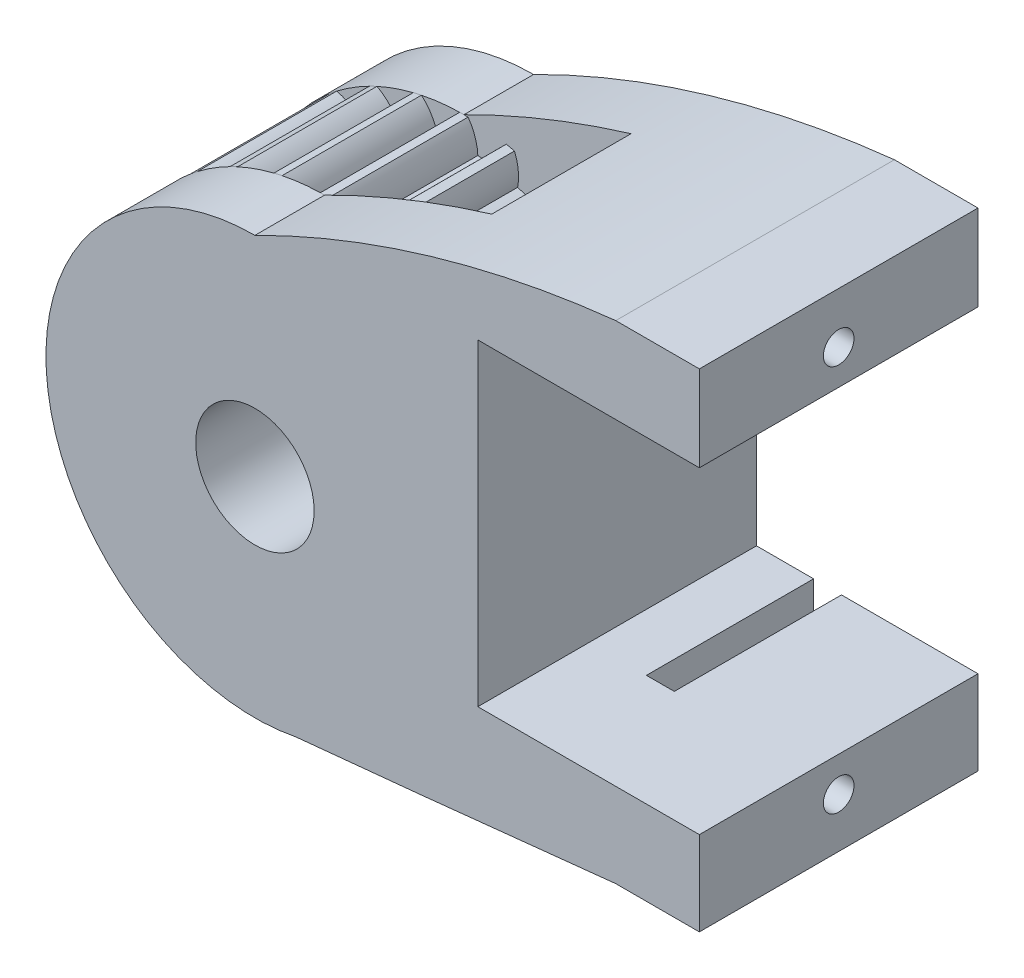
from build123d import *

# Parameters (mm, degrees)
SKETCH2_R           = 13
SKETCH2_R_2         = 4.25
BOSS_EXTRUDE1_DEPTH = 10
BOSS_EXTRUDE2_DEPTH = 10
CIRPATTERN1_COUNT   = 28
SKETCH3_R           = 15
SKETCH3_R_2         = 7.5
BOSS_EXTRUDE3_DEPTH = 5
SKETCH5_R           = 7.5
SKETCH5_R_2         = 4.25
BOSS_EXTRUDE4_DEPTH = 5
SKETCH6_W           = 6
SKETCH6_H           = 6.15
SKETCH6_H_2         = 6.05
BOSS_EXTRUDE7_DEPTH = 10
BOSS_EXTRUDE8_DEPTH = 5
CUT_EXTRUDE6_DEPTH  = 5
SKETCH18_R          = 1.1
CUT_EXTRUDE7_DEPTH  = 5
SKETCH20_W          = 2
SKETCH20_H          = 7.74649067
CUT_EXTRUDE10_DEPTH = 12


# Read off the part's stored shape, not the designer's step: Cut-Extrude6
with BuildPart() as part:
    # Sketch2 → Boss-Extrude1 (new body)
    with BuildSketch(Plane.XY):
        Circle(SKETCH2_R)
        Circle(SKETCH2_R_2, mode=Mode.SUBTRACT)
    extrude(amount=BOSS_EXTRUDE1_DEPTH)

    # Sketch2<3> → Boss-Extrude2 (add)
    with BuildSketch(Plane.XY):
        with BuildLine():
            ThreePointArc((1, 12.961481397), (0.8, 14.03224869), (0.3, 15))
            Line((0.3, 15), (-0.3, 15))
            ThreePointArc((-0.3, 15), (-0.8, 14.03224869), (-1, 12.961481397))
            ThreePointArc((-1, 12.961481397), (0, 13), (1, 12.961481397))
        make_face()
    boss_extrude2 = extrude(amount=BOSS_EXTRUDE2_DEPTH)

    # CirPattern1: Boss-Extrude2 ×28 about axis
    cirpattern1_axis = Axis((0, 0, 0), (0, 0, 1))
    for i in range(1, CIRPATTERN1_COUNT):
        add(boss_extrude2.rotate(cirpattern1_axis, i * 360 / CIRPATTERN1_COUNT))

    # Sketch3 → Boss-Extrude3 (add)
    with BuildSketch(Plane.XY.offset(10)):
        Circle(SKETCH3_R)
        Circle(SKETCH3_R_2, mode=Mode.SUBTRACT)
    boss_extrude3 = extrude(amount=BOSS_EXTRUDE3_DEPTH)

    # Sketch5 → Boss-Extrude4 (add)
    with BuildSketch(Plane.XY.offset(10)):
        Circle(SKETCH5_R)
        Circle(SKETCH5_R_2, mode=Mode.SUBTRACT)
    extrude(amount=BOSS_EXTRUDE4_DEPTH)

    # Sketch6 → Boss-Extrude7 (add)
    with BuildSketch(Plane.XY):
        with Locations((28.9, 19.575)):
            Rectangle(SKETCH6_W, SKETCH6_H)
        with Locations((28.9, -9.325)):
            Rectangle(SKETCH6_W, SKETCH6_H_2)
        with BuildLine():
            Line((25.9, -12.35), (25.9, -6.3))
            Line((25.9, -6.3), (16, -6.3))
            Line((16, -6.3), (13.612861565, -6.3))
            ThreePointArc((13.612861565, -6.3), (12.877389852, -7.692387835), (12, -9))
            Line((12, -9), (12, -13.81221778))
            Line((12, -13.81221778), (25.9, -12.35))
        make_face()
        with BuildLine():
            Line((16, 16.5), (25.9, 16.5))
            Line((25.9, 16.5), (25.9, 22.65))
            ThreePointArc((25.9, 22.65), (18.882932157, 21.564142143), (12, 19.819558151))
            Line((12, 19.819558151), (12, 9))
            ThreePointArc((12, 9), (14.917344582, 1.572523643), (13.612861565, -6.3))
            Line((13.612861565, -6.3), (16, -6.3))
            Line((16, -6.3), (16, 16.5))
        make_face()
        with BuildLine():
            ThreePointArc((12, -9), (12.877389852, -7.692387835), (13.612861565, -6.3))
            ThreePointArc((13.612861565, -6.3), (14.917344582, 1.572523643), (12, 9))
            Line((12, 9), (12, -9))
        make_face()
    extrude(amount=BOSS_EXTRUDE7_DEPTH)

    # Mirror1: Boss-Extrude3 across plane
    add(boss_extrude3.mirror(Plane(origin=(0, 0, 5), x_dir=(1, 0, 0), z_dir=(0, 0, -1))))

    # Sketch16 → Boss-Extrude8 (add)
    with BuildSketch(Plane.XY.offset(10)):
        with BuildLine():
            Line((25.9, 22.65), (31.9, 22.65))
            Line((31.9, 22.65), (31.9, 16.5))
            Line((31.9, 16.5), (16, 16.5))
            Line((16, 16.5), (16, -6.3))
            Line((16, -6.3), (31.9, -6.3))
            Line((31.9, -6.3), (31.9, -12.35))
            Line((31.9, -12.35), (25.9, -12.35))
            Line((25.9, -12.35), (12, -13.81221778))
            Line((12, -13.81221778), (0, -15))
            Line((0, -15), (0, -4.25))
            ThreePointArc((0, -4.25), (4.25, 0), (0, 4.25))
            Line((0, 4.25), (0, 15))
            ThreePointArc((0, 15), (12.602835008, 20.000369059), (25.9, 22.65))
        make_face()
    extrude(amount=BOSS_EXTRUDE8_DEPTH)

    # Cut-Extrude6 outline → Cut-Extrude6 (add)
    with BuildSketch(Plane(origin=(0, 0, 0), x_dir=(-1, 0, 0), z_dir=(0, 0, -1))):
        with BuildLine():
            Line((-31.9, -12.35), (-25.9, -12.35))
            Line((-25.9, -12.35), (-12, -13.81221778))
            Line((-12, -13.81221778), (-2.940644854, -14.708929527))
            ThreePointArc((-2.940644854, -14.708929527), (-14.927055016, 1.477507545), (0, 15))
            ThreePointArc((0, 15), (-12.602835008, 20.000369059), (-25.9, 22.65))
            Line((-25.9, 22.65), (-31.9, 22.65))
            Line((-31.9, 22.65), (-31.9, 16.5))
            Line((-31.9, 16.5), (-16, 16.5))
            Line((-16, 16.5), (-16, -6.3))
            Line((-16, -6.3), (-31.9, -6.3))
            Line((-31.9, -6.3), (-31.9, -12.35))
        make_face()
    extrude(amount=CUT_EXTRUDE6_DEPTH)

    # Sketch18 → Cut-Extrude7 (cut)
    with BuildSketch(Plane(origin=(31.9, 0, 0), x_dir=(0, 0, -1), z_dir=(1, 0, 0))):
        with Locations((-5, 19)):
            Circle(SKETCH18_R)
        with Locations((-5, -8.8)):
            Circle(SKETCH18_R)
    extrude(amount=-CUT_EXTRUDE7_DEPTH, mode=Mode.SUBTRACT)

    # Sketch20 → Cut-Extrude10 (cut)
    with BuildSketch(Plane(origin=(0, 0, -5), x_dir=(-1, 0, 0), z_dir=(0, 0, -1))):
        with Locations((-21.1, -10.173245335)):
            Rectangle(SKETCH20_W, SKETCH20_H)
    extrude(amount=-CUT_EXTRUDE10_DEPTH, mode=Mode.SUBTRACT)


solid = part.part
